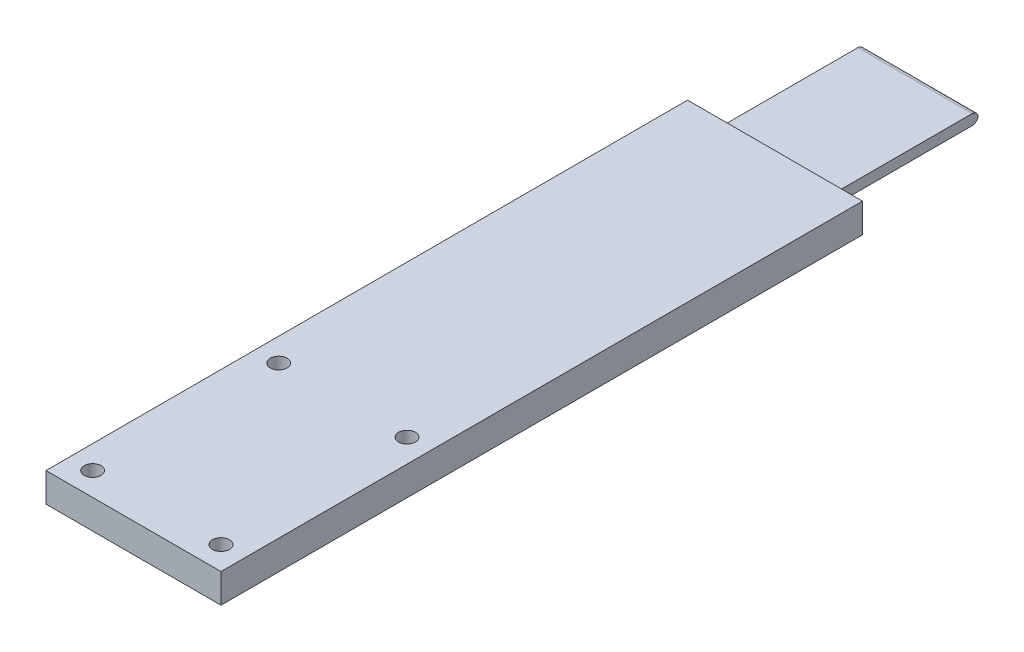
from build123d import *

# Parameters (mm, degrees)
SKETCH_1_W          = 30
SKETCH_1_H          = 5
EXTRUDE_1_DEPTH     = 110
SKETCH_2_R          = 1.45
CUT_EXTRUDE_1_DEPTH = 60
SKETCH_4_W          = 19.6
SKETCH_4_H          = 1.8
EXTRUDE_2_DEPTH     = 25
FILLET_1_R          = 1


with BuildPart() as part:
    # 草图1 → 凸台-拉伸1 (new body)
    with BuildSketch(Plane.XY):
        with Locations((-15, 2.5)):
            Rectangle(SKETCH_1_W, SKETCH_1_H)
    extrude(amount=EXTRUDE_1_DEPTH)

    # 草图2 → 切除-拉伸1 (cut)
    with BuildSketch(Plane(origin=(0, 5, 0), x_dir=(1, 0, 0), z_dir=(0, 1, 0))):
        with Locations(Location((-26, -106, 0), (0, 0, 180))):
            Circle(SKETCH_2_R)
        with Locations(Location((-26, -74.1, 0), (0, 0, 180))):
            Circle(SKETCH_2_R)
        with Locations(Location((-4, -106, 0), (0, 0, 270))):
            Circle(SKETCH_2_R)
        with Locations(Location((-4, -74.1, 0), (0, 0, 270))):
            Circle(SKETCH_2_R)
    extrude(amount=-CUT_EXTRUDE_1_DEPTH, mode=Mode.SUBTRACT)

    # 草图4 → 凸台-拉伸2 (add)
    with BuildSketch(Plane(origin=(0, 0, 0), x_dir=(-1, 0, 0), z_dir=(0, 0, -1))):
        with Locations((15, 2.5)):
            Rectangle(SKETCH_4_W, SKETCH_4_H)
    extrude(amount=EXTRUDE_2_DEPTH)

    # 圆角1
    # the kernel refuses this fillet: 1 mm, written as the material it takes off along each edge
    with BuildSketch(Plane(origin=(-27.3, 1.6, -25), x_dir=(0, 0, 1), z_dir=(1, 0, 0)), Plane(origin=(-2.7, 3.4, -25), x_dir=(0, 0, 1), z_dir=(-1, 0, 0))) as fillet_1_piece_1:
        with BuildLine():
            CenterArc((FILLET_1_R, -FILLET_1_R), FILLET_1_R, 90, 90)
            Line((0, -FILLET_1_R), (0, 0))
            Line((0, 0), (FILLET_1_R, 0))
        make_face()
    extrude(amount=24.6, mode=Mode.SUBTRACT)


solid = part.part
